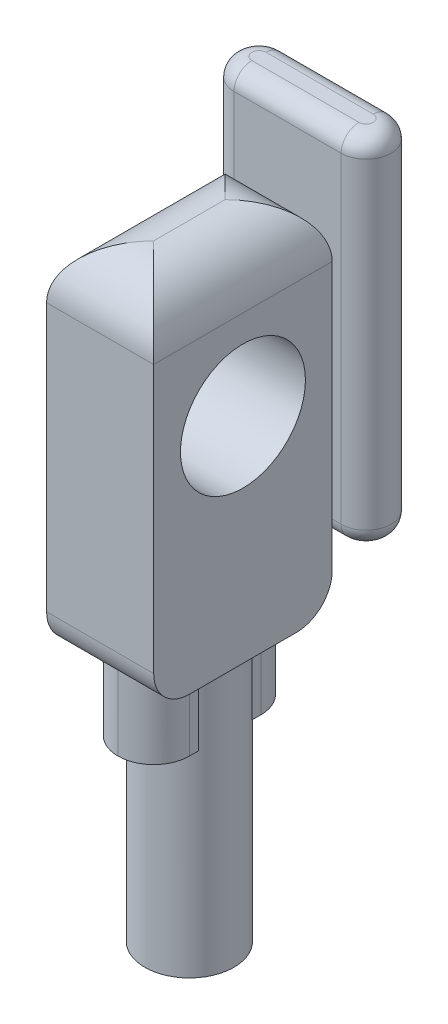
from build123d import *

# Parameters (mm, degrees)
SKETCH1_W                = 15.24
SKETCH1_H                = 25.4
BOSS_EXTRUDE1_DEPTH      = 5.08
FILLET1_R                = 2.54
SKETCH2_R                = 3.175
BOSS_EXTRUDE2_DEPTH      = 6.35
SKETCH3_W                = 5.08
SKETCH3_H                = 10.16
BOSS_EXTRUDE3_DEPTH      = 5.08
SKETCH4_W                = 7.62
SKETCH4_H                = 12.7
BOSS_EXTRUDE4_DEPTH      = 25.4
FILLET2_R                = 2.54
FILLET3_R                = 3.81
SKETCH5_R                = 1.905
BOSS_EXTRUDE5_DEPTH      = 1.27
BOSS_EXTRUDE6_DEPTH      = 25.4
FILLET4_R                = 1.27
SKETCH7_W                = 5.588
SKETCH7_H                = 21.59
CUT_EXTRUDE1_DEPTH       = 1.016
FILLET5_R                = 0.254
CUT_EXTRUDE2_REACH       = 52.512
SKETCH8_R                = 4.445
FILLET6_R                = 0.635
CUT_EXTRUDE3_REACH       = 55.308
SKETCH9_W                = 15.24
SKETCH9_H                = 25.4
BOSS_EXTRUDE7_DEPTH      = 13.97
BOSS_EXTRUDE7_DEPTH_BACK = 5.08
SKETCH10_R               = 3.175
FILLET7_R                = 2.54


# Some blends are built 0.0001 mm under size
with BuildPart() as part:
    # Sketch1 → Boss-Extrude1 (new, symmetric)
    with BuildSketch(Plane(origin=(0, 0, 0), x_dir=(0, 0, -1), z_dir=(1, 0, 0))):
        Rectangle(SKETCH1_W, SKETCH1_H)
    extrude(amount=BOSS_EXTRUDE1_DEPTH, both=True)

    # Fillet1
    fillet1_edges = [part.edges().sort_by_distance(p)[0] for p in [
        (5.08, 0, 7.62),
        (5.08, -12.7, 0),
        (5.08, 0, -7.62),
        (-5.08, -12.7, 0),
        (-5.08, 0, 7.62),
        (-5.08, 12.7, 0),
        (-5.08, 0, -7.62),
        (5.08, 12.7, 0),
        (0, -12.7, -7.62),
        (0, -12.7, 7.62),
        (0, 12.7, 7.62),
        (0, 12.7, -7.62),
    ]]
    fillet(fillet1_edges, radius=FILLET1_R)

    # Sketch2 → Boss-Extrude2 (add)
    with BuildSketch(Plane(origin=(5.08, 0, 0), x_dir=(0, 0, -1), z_dir=(1, 0, 0))):
        with Locations(Location((0, 6.985, 0), (0, 0, 90))):
            Circle(SKETCH2_R)
        with Locations(Location((0, -6.985, 0), (0, 0, 270))):
            Circle(SKETCH2_R)
    boss_extrude2 = extrude(amount=BOSS_EXTRUDE2_DEPTH)

    # Mirror1: Boss-Extrude2 across plane
    add(boss_extrude2.mirror(Plane(origin=(0, 0, 0), x_dir=(0, 0, 1), z_dir=(1, 0, 0))))

    # Sketch3 → Boss-Extrude3 (add)
    with BuildSketch(Plane(origin=(0, 12.7, 0), x_dir=(1, 0, 0), z_dir=(0, 1, 0))):
        Rectangle(SKETCH3_W, SKETCH3_H)
    extrude(amount=BOSS_EXTRUDE3_DEPTH)

    # Sketch4 → Boss-Extrude4 (add)
    with BuildSketch(Plane(origin=(0, 17.78, 0), x_dir=(1, 0, 0), z_dir=(0, 1, 0))):
        Rectangle(SKETCH4_W, SKETCH4_H)
    extrude(amount=BOSS_EXTRUDE4_DEPTH)

    # Fillet2
    # the kernel refuses this fillet: 2.54 mm, written as the material it takes off along each edge
    with BuildSketch(Plane(origin=(10.16, 17.78, -6.35), x_dir=(0, 0, 1), z_dir=(-1, 0, 0))) as fillet2_piece_1_section:
        with BuildLine():
            CenterArc((FILLET2_R, FILLET2_R), FILLET2_R, 180, 90)
            Line((0, FILLET2_R), (0, 0))
            Line((0, 0), (FILLET2_R, 0))
        make_face()
    fillet2_piece_1 = extrude(amount=20.32, mode=Mode.PRIVATE)
    fillet2_piece_1 = split(fillet2_piece_1, bisect_by=Plane(origin=(6.35, 17.840981289, -5.08), z_dir=(0, 0, 1)), keep=Keep.TOP, mode=Mode.PRIVATE)
    fillet2_piece_1 = split(fillet2_piece_1, bisect_by=Plane(origin=(2.54, 17.840981289, -4.665343007), z_dir=(1, 0, 0)), keep=Keep.TOP, mode=Mode.PRIVATE)
    add(fillet2_piece_1, mode=Mode.SUBTRACT)
    with BuildSketch(Plane(origin=(10.16, 17.78, -6.35), x_dir=(0, 0, 1), z_dir=(-1, 0, 0))) as fillet2_piece_2_section:
        with BuildLine():
            CenterArc((FILLET2_R, FILLET2_R), FILLET2_R, 180, 90)
            Line((0, FILLET2_R), (0, 0))
            Line((0, 0), (FILLET2_R, 0))
        make_face()
    fillet2_piece_2 = extrude(amount=20.32, mode=Mode.PRIVATE)
    fillet2_piece_2 = split(fillet2_piece_2, bisect_by=Plane(origin=(6.35, 18.428004952, -5.08), z_dir=(0, 0, -1)), keep=Keep.TOP, mode=Mode.PRIVATE)
    fillet2_piece_2 = split(fillet2_piece_2, bisect_by=Plane(origin=(2.54, 18.428004952, -5.932444919), z_dir=(1, 0, 0)), keep=Keep.TOP, mode=Mode.PRIVATE)
    add(fillet2_piece_2, mode=Mode.SUBTRACT)
    with BuildSketch(Plane(origin=(10.16, 17.78, -6.35), x_dir=(0, 0, 1), z_dir=(-1, 0, 0))) as fillet2_piece_3_section:
        with BuildLine():
            CenterArc((FILLET2_R, FILLET2_R), FILLET2_R, 180, 90)
            Line((0, FILLET2_R), (0, 0))
            Line((0, 0), (FILLET2_R, 0))
        make_face()
    fillet2_piece_3 = extrude(amount=20.32, mode=Mode.PRIVATE)
    fillet2_piece_3 = split(fillet2_piece_3, bisect_by=Plane(origin=(0, 18.428004952, -5.08), z_dir=(0, 0, -1)), keep=Keep.TOP, mode=Mode.PRIVATE)
    fillet2_piece_3 = split(fillet2_piece_3, bisect_by=Plane(origin=(-2.54, 18.428004952, -5.932444919), z_dir=(1, 0, 0)), keep=Keep.TOP, mode=Mode.PRIVATE)
    fillet2_piece_3 = split(fillet2_piece_3, bisect_by=Plane(origin=(2.54, 18.428004952, -5.932444919), z_dir=(-1, 0, 0)), keep=Keep.TOP, mode=Mode.PRIVATE)
    add(fillet2_piece_3, mode=Mode.SUBTRACT)
    with BuildSketch(Plane(origin=(10.16, 17.78, -6.35), x_dir=(0, 0, 1), z_dir=(-1, 0, 0))) as fillet2_piece_4_section:
        with BuildLine():
            CenterArc((FILLET2_R, FILLET2_R), FILLET2_R, 180, 90)
            Line((0, FILLET2_R), (0, 0))
            Line((0, 0), (FILLET2_R, 0))
        make_face()
    fillet2_piece_4 = extrude(amount=20.32, mode=Mode.PRIVATE)
    fillet2_piece_4 = split(fillet2_piece_4, bisect_by=Plane(origin=(-6.35, 17.840981289, -5.08), z_dir=(0, 0, 1)), keep=Keep.TOP, mode=Mode.PRIVATE)
    fillet2_piece_4 = split(fillet2_piece_4, bisect_by=Plane(origin=(-2.54, 17.840981289, -4.665343007), z_dir=(-1, 0, 0)), keep=Keep.TOP, mode=Mode.PRIVATE)
    add(fillet2_piece_4, mode=Mode.SUBTRACT)
    with BuildSketch(Plane(origin=(10.16, 17.78, -6.35), x_dir=(0, 0, 1), z_dir=(-1, 0, 0))) as fillet2_piece_5_section:
        with BuildLine():
            CenterArc((FILLET2_R, FILLET2_R), FILLET2_R, 180, 90)
            Line((0, FILLET2_R), (0, 0))
            Line((0, 0), (FILLET2_R, 0))
        make_face()
    fillet2_piece_5 = extrude(amount=20.32, mode=Mode.PRIVATE)
    fillet2_piece_5 = split(fillet2_piece_5, bisect_by=Plane(origin=(-6.35, 18.428004952, -5.08), z_dir=(0, 0, -1)), keep=Keep.TOP, mode=Mode.PRIVATE)
    fillet2_piece_5 = split(fillet2_piece_5, bisect_by=Plane(origin=(-2.54, 18.428004952, -5.932444919), z_dir=(-1, 0, 0)), keep=Keep.TOP, mode=Mode.PRIVATE)
    add(fillet2_piece_5, mode=Mode.SUBTRACT)
    with BuildSketch(Plane(origin=(-10.16, 17.78, 6.35), x_dir=(0, 1, 0), z_dir=(1, 0, 0))) as fillet2_piece_6_section:
        with BuildLine():
            CenterArc((FILLET2_R, -FILLET2_R), FILLET2_R, 90, 90)
            Line((0, -FILLET2_R), (0, 0))
            Line((0, 0), (FILLET2_R, 0))
        make_face()
    fillet2_piece_6 = extrude(amount=20.32, mode=Mode.PRIVATE)
    fillet2_piece_6 = split(fillet2_piece_6, bisect_by=Plane(origin=(-2.54, 18.428004952, 5.932444919), z_dir=(-1, 0, 0)), keep=Keep.TOP, mode=Mode.PRIVATE)
    fillet2_piece_6 = split(fillet2_piece_6, bisect_by=Plane(origin=(-6.35, 18.428004952, 5.08), z_dir=(0, 0, 1)), keep=Keep.TOP, mode=Mode.PRIVATE)
    add(fillet2_piece_6, mode=Mode.SUBTRACT)
    with BuildSketch(Plane(origin=(-10.16, 17.78, 6.35), x_dir=(0, 1, 0), z_dir=(1, 0, 0))) as fillet2_piece_7_section:
        with BuildLine():
            CenterArc((FILLET2_R, -FILLET2_R), FILLET2_R, 90, 90)
            Line((0, -FILLET2_R), (0, 0))
            Line((0, 0), (FILLET2_R, 0))
        make_face()
    fillet2_piece_7 = extrude(amount=20.32, mode=Mode.PRIVATE)
    fillet2_piece_7 = split(fillet2_piece_7, bisect_by=Plane(origin=(-2.54, 17.840981289, 4.665343007), z_dir=(-1, 0, 0)), keep=Keep.TOP, mode=Mode.PRIVATE)
    fillet2_piece_7 = split(fillet2_piece_7, bisect_by=Plane(origin=(-6.35, 17.840981289, 5.08), z_dir=(0, 0, -1)), keep=Keep.TOP, mode=Mode.PRIVATE)
    add(fillet2_piece_7, mode=Mode.SUBTRACT)
    with BuildSketch(Plane(origin=(-10.16, 17.78, 6.35), x_dir=(0, 1, 0), z_dir=(1, 0, 0))) as fillet2_piece_8_section:
        with BuildLine():
            CenterArc((FILLET2_R, -FILLET2_R), FILLET2_R, 90, 90)
            Line((0, -FILLET2_R), (0, 0))
            Line((0, 0), (FILLET2_R, 0))
        make_face()
    fillet2_piece_8 = extrude(amount=20.32, mode=Mode.PRIVATE)
    fillet2_piece_8 = split(fillet2_piece_8, bisect_by=Plane(origin=(-2.54, 18.428004952, 5.932444919), z_dir=(1, 0, 0)), keep=Keep.TOP, mode=Mode.PRIVATE)
    fillet2_piece_8 = split(fillet2_piece_8, bisect_by=Plane(origin=(0, 18.428004952, 5.08), z_dir=(0, 0, 1)), keep=Keep.TOP, mode=Mode.PRIVATE)
    fillet2_piece_8 = split(fillet2_piece_8, bisect_by=Plane(origin=(2.54, 18.428004952, 5.932444919), z_dir=(-1, 0, 0)), keep=Keep.TOP, mode=Mode.PRIVATE)
    add(fillet2_piece_8, mode=Mode.SUBTRACT)
    with BuildSketch(Plane(origin=(-10.16, 17.78, 6.35), x_dir=(0, 1, 0), z_dir=(1, 0, 0))) as fillet2_piece_9_section:
        with BuildLine():
            CenterArc((FILLET2_R, -FILLET2_R), FILLET2_R, 90, 90)
            Line((0, -FILLET2_R), (0, 0))
            Line((0, 0), (FILLET2_R, 0))
        make_face()
    fillet2_piece_9 = extrude(amount=20.32, mode=Mode.PRIVATE)
    fillet2_piece_9 = split(fillet2_piece_9, bisect_by=Plane(origin=(6.35, 18.428004952, 5.08), z_dir=(0, 0, 1)), keep=Keep.TOP, mode=Mode.PRIVATE)
    fillet2_piece_9 = split(fillet2_piece_9, bisect_by=Plane(origin=(2.54, 18.428004952, 5.932444919), z_dir=(1, 0, 0)), keep=Keep.TOP, mode=Mode.PRIVATE)
    add(fillet2_piece_9, mode=Mode.SUBTRACT)
    with BuildSketch(Plane(origin=(-10.16, 17.78, 6.35), x_dir=(0, 1, 0), z_dir=(1, 0, 0))) as fillet2_piece_10_section:
        with BuildLine():
            CenterArc((FILLET2_R, -FILLET2_R), FILLET2_R, 90, 90)
            Line((0, -FILLET2_R), (0, 0))
            Line((0, 0), (FILLET2_R, 0))
        make_face()
    fillet2_piece_10 = extrude(amount=20.32, mode=Mode.PRIVATE)
    fillet2_piece_10 = split(fillet2_piece_10, bisect_by=Plane(origin=(6.35, 17.840981289, 5.08), z_dir=(0, 0, -1)), keep=Keep.TOP, mode=Mode.PRIVATE)
    fillet2_piece_10 = split(fillet2_piece_10, bisect_by=Plane(origin=(2.54, 17.840981289, 4.665343007), z_dir=(1, 0, 0)), keep=Keep.TOP, mode=Mode.PRIVATE)
    add(fillet2_piece_10, mode=Mode.SUBTRACT)

    # Fillet3
    fillet3_edges = [part.edges().sort_by_distance(p)[0] for p in [
        (3.81, 43.18, 0),
        (0, 43.18, -6.35),
        (-3.81, 43.18, 0),
        (0, 43.18, 6.35),
    ]]
    fillet(fillet3_edges, radius=FILLET3_R - 0.0001)  # a hair under: the kernel refuses the full size

    # Sketch5 → Boss-Extrude5 (add)
    with BuildSketch(Plane(origin=(0, 0, -6.35), x_dir=(-1, 0, 0), z_dir=(0, 0, -1))):
        with Locations(Location((0, 32.385, 0), (0, 0, 180))):
            Circle(SKETCH5_R)
        with Locations(Location((0, 25.4, 0), (0, 0, 180))):
            Circle(SKETCH5_R)
    extrude(amount=BOSS_EXTRUDE5_DEPTH)

    # Sketch6 → Boss-Extrude6 (add)
    with BuildSketch(Plane(origin=(0, 21.59, 0), x_dir=(1, 0, 0), z_dir=(0, 1, 0))):
        with BuildLine():
            Line((-3.81, 10.541), (3.81, 10.541))
            ThreePointArc((3.81, 10.541), (5.588, 8.763), (3.81, 6.985))
            Line((3.81, 6.985), (-3.81, 6.985))
            ThreePointArc((-3.81, 6.985), (-5.588, 8.763), (-3.81, 10.541))
        make_face()
    extrude(amount=BOSS_EXTRUDE6_DEPTH)

    # Fillet4
    fillet4_edges = [part.edges().sort_by_distance(p)[0] for p in [
        (0, 21.59, -6.985),
        (-5.588, 21.59, -8.763),
        (5.588, 21.59, -8.763),
        (0, 21.59, -10.541),
        (-5.588, 46.99, -8.763),
        (0, 46.99, -6.985),
        (5.588, 46.99, -8.763),
        (0, 46.99, -10.541),
    ]]
    fillet(fillet4_edges, radius=FILLET4_R)

    # Sketch7 → Cut-Extrude1 (cut)
    with BuildSketch(Plane(origin=(0, 0, -10.541), x_dir=(-1, 0, 0), z_dir=(0, 0, -1))):
        with Locations((0, 34.29)):
            Rectangle(SKETCH7_W, SKETCH7_H)
    extrude(amount=-CUT_EXTRUDE1_DEPTH, mode=Mode.SUBTRACT)

    # Fillet5
    fillet5_edges = [part.edges().sort_by_distance(p)[0] for p in [
        (-2.794, 34.29, -10.541),
        (0, 45.085, -10.541),
        (2.794, 34.29, -10.541),
        (0, 23.495, -10.541),
    ]]
    fillet(fillet5_edges, radius=FILLET5_R)

    # Sketch8 → Cut-Extrude2 (cut, up to next)
    with BuildSketch(Plane(origin=(3.81, 0, 0), x_dir=(0, 0, -1), z_dir=(1, 0, 0)), mode=Mode.PRIVATE) as cut_extrude2_sk1:
        with Locations((0, 33.02)):
            Circle(SKETCH8_R)
    cut_extrude2_tool1 = extrude(cut_extrude2_sk1.sketch, amount=-CUT_EXTRUDE2_REACH, mode=Mode.PRIVATE) & part.part
    add(cut_extrude2_tool1.solids().sort_by_distance((3.81, 33.02, 0))[0], mode=Mode.SUBTRACT)

    # Fillet6
    fillet6_edges = [part.edges().sort_by_distance(p)[0] for p in [
        (11.43, 3.81, 0),
        (11.43, -3.81, 0),
        (-11.43, 3.81, 0),
        (-11.43, -3.81, 0),
    ]]
    fillet(fillet6_edges, radius=FILLET6_R)

    # Sketch9 → Cut-Extrude3 (cut, up to next)
    with BuildSketch(Plane(origin=(11.43, 0, 0), x_dir=(0, 0, -1), z_dir=(1, 0, 0)), mode=Mode.PRIVATE) as cut_extrude3_sk1:
        Rectangle(SKETCH9_W, SKETCH9_H)
    cut_extrude3_tool1 = extrude(cut_extrude3_sk1.sketch, amount=-CUT_EXTRUDE3_REACH, mode=Mode.PRIVATE) & part.part
    add(cut_extrude3_tool1.solids().sort_by_distance((11.43, 0, 0))[0], mode=Mode.SUBTRACT)

    # Sketch10 → Boss-Extrude7 (add, two sides: drawn at the far end of the back side and taken through both)
    with BuildSketch(Plane.XZ.offset(-12.7).offset(-BOSS_EXTRUDE7_DEPTH_BACK)):
        with Locations(Location((0, 0, 0), (0, 0, 270))):
            Circle(SKETCH10_R)
    extrude(amount=BOSS_EXTRUDE7_DEPTH + BOSS_EXTRUDE7_DEPTH_BACK)

    # Fillet7
    fillet7_edges = [part.edges().sort_by_distance(p)[0] for p in [
        (-2.54, 15.410147737, 5.08),
        (2.54, 15.410147737, 5.08),
        (-2.54, 15.410147737, -5.08),
        (2.54, 15.410147737, -5.08),
    ]]
    fillet(fillet7_edges, radius=FILLET7_R - 0.0001)  # a hair under: the kernel refuses the full size


solid = part.part
